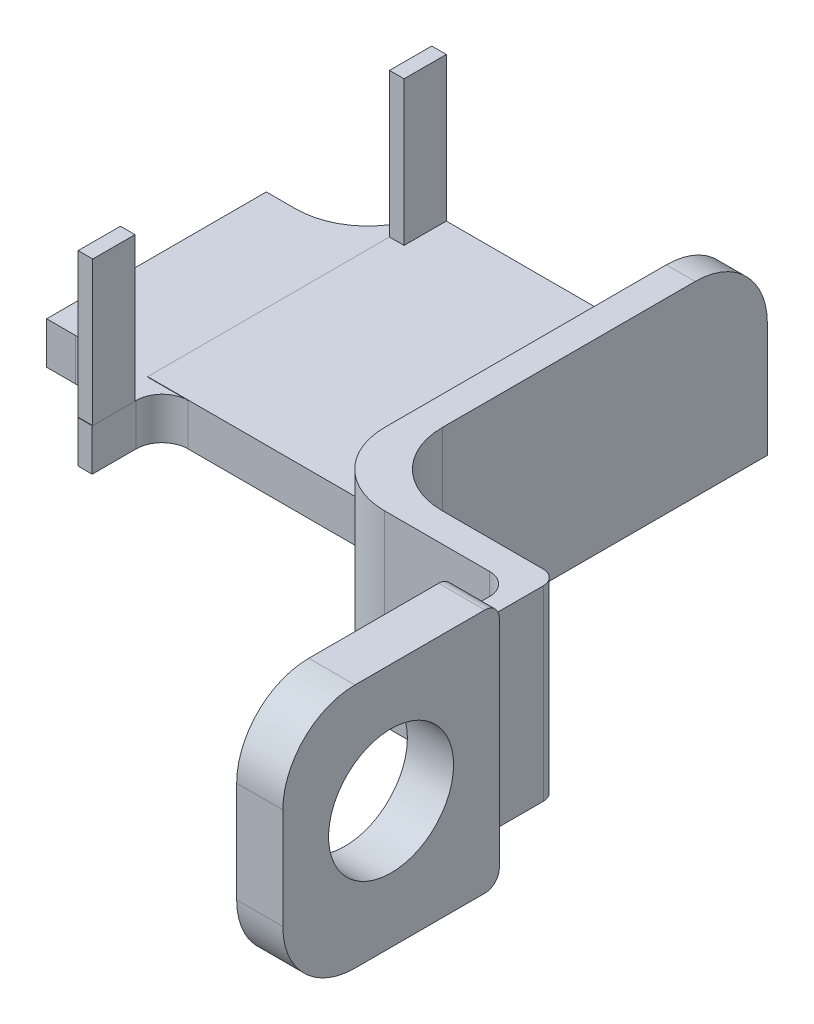
from build123d import *

# Parameters (mm, degrees)
SKETCH1_W            = 54
SKETCH1_H            = 50
BOSS_EXTRUDE1_DEPTH  = 7.460000066
SKETCH2_W            = 75
SKETCH2_H            = 7.460000066
BOSS_EXTRUDE2_DEPTH  = 5.08
SKETCH4_W            = 5.08
SKETCH4_H            = 75
BOSS_EXTRUDE3_DEPTH  = 25.4
FILLET1_R            = 12.7
SKETCH6_W            = 5.08
SKETCH6_H            = 32.860000066
BOSS_EXTRUDE4_DEPTH  = 33.02
FILLET2_R            = 12.7
FILLET3_R            = 12.7
SKETCH9_W            = 3.089134775
SKETCH9_H            = 32.860000066
BOSS_EXTRUDE5_DEPTH  = 10
SKETCH10_W           = 8.128
SKETCH10_H           = 43.18
BOSS_EXTRUDE6_DEPTH  = 38.1
FILLET4_R            = 12.7
FILLET5_R            = 2.54
SKETCH11_R           = 11
CUT_EXTRUDE1_DEPTH   = 38.1
FILLET6_R            = 2.54
FILLET7_R            = 3.81
SKETCH18_W           = 50.970977204
SKETCH18_H           = 7.39100176
BOSS_EXTRUDE8_DEPTH  = 17.78
FILLET12_R           = 12.7
SKETCH23_W           = 12.3
SKETCH23_H           = 7.39100176
BOSS_EXTRUDE9_DEPTH  = 7.62
SKETCH24_W           = 2.569580913
SKETCH24_H           = 7.435441969
BOSS_EXTRUDE10_DEPTH = 25.4
SKETCH28_W           = 17.78
SKETCH28_H           = 12.3
CUT_EXTRUDE8_DEPTH   = 25.4
FILLET14_R           = 12.7
SKETCH30_W           = 12.3
SKETCH30_H           = 7.39100176
CUT_EXTRUDE9_DEPTH   = 5.08
FILLET16_R           = 4.572


with BuildPart() as part:
    # Sketch1 → Boss-Extrude1 (new body)
    with BuildSketch(Plane(origin=(0, 0, 0), x_dir=(1, 0, 0), z_dir=(0, 1, 0))):
        with Locations((10.073929961, 6.712062257)):
            Rectangle(SKETCH1_W, SKETCH1_H)
    extrude(amount=BOSS_EXTRUDE1_DEPTH)

    # Sketch2 → Boss-Extrude2 (add)
    with BuildSketch(Plane(origin=(37.073929961, 0, 0), x_dir=(0, 0, -1), z_dir=(1, 0, 0))):
        with Locations((-5.787937743, 3.730000033)):
            Rectangle(SKETCH2_W, SKETCH2_H)
    extrude(amount=BOSS_EXTRUDE2_DEPTH)

    # Sketch4 → Boss-Extrude3 (add)
    with BuildSketch(Plane(origin=(0, 7.460000066, 0), x_dir=(1, 0, 0), z_dir=(0, 1, 0))):
        with Locations((39.613929961, -5.787937743)):
            Rectangle(SKETCH4_W, SKETCH4_H)
    extrude(amount=BOSS_EXTRUDE3_DEPTH)

    # Fillet1
    fillet1_edges = [part.edges().sort_by_distance(p)[0] for p in [
        (39.613929961, 32.860000066, -31.712062257),
    ]]
    fillet(fillet1_edges, radius=FILLET1_R)

    # Sketch6 → Boss-Extrude4 (add)
    with BuildSketch(Plane(origin=(42.153929961, 0, 0), x_dir=(0, 0, -1), z_dir=(1, 0, 0))):
        with Locations((-40.747937743, 16.430000033)):
            Rectangle(SKETCH6_W, SKETCH6_H)
    extrude(amount=BOSS_EXTRUDE4_DEPTH)

    # Fillet2
    fillet2_edges = [part.edges().sort_by_distance(p)[0] for p in [
        (42.153929961, 16.430000033, 38.207937743),
    ]]
    fillet(fillet2_edges, radius=FILLET2_R)

    # Fillet3
    fillet3_edges = [part.edges().sort_by_distance(p)[0] for p in [
        (37.073929961, 16.430000033, 43.287937743),
    ]]
    fillet(fillet3_edges, radius=FILLET3_R)

    # Sketch9 → Boss-Extrude5 (add)
    with BuildSketch(Plane.XY.offset(43.287937743)):
        with Locations((73.629362574, 16.430000033)):
            Rectangle(SKETCH9_W, SKETCH9_H)
    extrude(amount=BOSS_EXTRUDE5_DEPTH)

    # Sketch10 → Boss-Extrude6 (add)
    with BuildSketch(Plane.XY.offset(53.287937743)):
        with Locations((75.90492166, 17.526882494)):
            Rectangle(SKETCH10_W, SKETCH10_H)
    extrude(amount=BOSS_EXTRUDE6_DEPTH)

    # Fillet4
    fillet4_edges = [part.edges().sort_by_distance(p)[0] for p in [
        (75.90492166, 39.116882494, 91.387937743),
        (75.90492166, -4.063117506, 91.387937743),
    ]]
    fillet(fillet4_edges, radius=FILLET4_R)

    # Fillet5
    fillet5_edges = [part.edges().sort_by_distance(p)[0] for p in [
        (75.90492166, 39.116882494, 53.287937743),
        (75.90492166, -4.063117506, 53.287937743),
    ]]
    fillet(fillet5_edges, radius=FILLET5_R)

    # Sketch11 → Cut-Extrude1 (cut)
    with BuildSketch(Plane(origin=(79.96892166, 0, 0), x_dir=(0, 0, -1), z_dir=(1, 0, 0))):
        with Locations((-72.337937743, 18.275557959)):
            Circle(SKETCH11_R)
    extrude(amount=-CUT_EXTRUDE1_DEPTH, mode=Mode.SUBTRACT)

    # Fillet6
    fillet6_edges = [part.edges().sort_by_distance(p)[0] for p in [
        (75.173929961, 16.430000033, 38.207937743),
    ]]
    fillet(fillet6_edges, radius=FILLET6_R)

    # Fillet7
    fillet7_edges = [part.edges().sort_by_distance(p)[0] for p in [
        (72.084795186, 16.430000033, 43.287937743),
    ]]
    fillet(fillet7_edges, radius=FILLET7_R)

    # Sketch18 → Boss-Extrude8 (add)
    with BuildSketch(Plane.ZY.offset(16.926070039)):
        with Locations((5.102449141, 3.69550088)):
            Rectangle(SKETCH18_W, SKETCH18_H)
    extrude(amount=BOSS_EXTRUDE8_DEPTH)

    # Fillet12
    # the kernel refuses this fillet: 12.7 mm, written as the material it adds along each edge
    with BuildSketch(Plane(origin=(-16.926070039, 7.39100176, -20.383039461), x_dir=(0, 0, -1), z_dir=(0, -1, 0))) as fillet12_piece_1:
        with BuildLine():
            CenterArc((12.7, -12.625783996), FILLET12_R, 96.197210877, 83.802789123)
            Line((0, -12.625783996), (-0.254, -12.625783996))
            Line((-0.254, -12.625783996), (-0.254, 0))
            Line((-0.254, 0), (0, 0.254))
            ThreePointArc((0, 0.254), (5.664511398, 0.254), (11.301603252, 0.25251568))
            Line((11.301603252, 0.25251568), (11.329022796, 0))
        make_face()
    extrude(amount=7.39100176)

    # Sketch23 → Boss-Extrude9 (add)
    with BuildSketch(Plane(origin=(-16.926070039, 0, 0), x_dir=(0, 0, -1), z_dir=(1, 0, 0))):
        with Locations((-24.437937743, 3.69550088)):
            Rectangle(SKETCH23_W, SKETCH23_H)
    extrude(amount=BOSS_EXTRUDE9_DEPTH)

    # Sketch24 → Boss-Extrude10 (add)
    with BuildSketch(Plane(origin=(0, 7.460000066, 0), x_dir=(1, 0, 0), z_dir=(0, 1, 0))):
        with Locations((-15.641279583, 27.994341273)):
            Rectangle(SKETCH24_W, SKETCH24_H)
        with Locations((-15.571212374, -26.873353003)):
            Rectangle(SKETCH24_W, SKETCH24_H)
    extrude(amount=BOSS_EXTRUDE10_DEPTH)


with BuildPart() as boss_extrude10_piece_1:
    # of the separate pieces the step leaves, piece 1, a body of its own (boss_extrude10_pieces)
    add(part.part.solids().sort_by_distance((-16.926070039, 0, -31.712062257))[0])

    # Sketch28 → Cut-Extrude8 (cut)
    with BuildSketch(Plane(origin=(0, 7.39100176, 0), x_dir=(1, 0, 0), z_dir=(0, 1, 0))):
        with Locations((-25.816070039, -24.437937743)):
            Rectangle(SKETCH28_W, SKETCH28_H)
    extrude(amount=-CUT_EXTRUDE8_DEPTH, mode=Mode.SUBTRACT)

    # Fillet14
    # the kernel refuses this fillet: 12.7 mm, written as the material it adds along each edge
    with BuildSketch(Plane(origin=(-16.926070039, 7.39100176, 18.287937743), x_dir=(-1, 0, 0), z_dir=(0, -1, 0))) as fillet14_piece_1:
        with BuildLine():
            CenterArc((12.693699224, -12.7), FILLET14_R, 90, 88.195110026)
            Line((0, -12.3), (-0.253873984, -12.292))
            ThreePointArc((-0.253873984, -12.292), (-0.254, -6.15), (-0.254, 0))
            Line((-0.254, 0), (0, 0.254))
            Line((0, 0.254), (12.693699224, 0.254))
            Line((12.693699224, 0.254), (12.693699224, 0))
        make_face()
    extrude(amount=7.39100176)

    # Sketch30 → Cut-Extrude9 (cut)
    with BuildSketch(Plane(origin=(-9.306070039, 0, 0), x_dir=(0, 0, -1), z_dir=(1, 0, 0))):
        with Locations((-24.437937743, 3.69550088)):
            Rectangle(SKETCH30_W, SKETCH30_H)
    extrude(amount=-CUT_EXTRUDE9_DEPTH, mode=Mode.SUBTRACT)

    # Fillet16
    fillet16_edges = [boss_extrude10_piece_1.edges().sort_by_distance(p)[0] for p in [
        (-14.386070039, 3.69550088, 18.287937743),
    ]]
    fillet(fillet16_edges, radius=FILLET16_R)


with BuildPart() as boss_extrude10_piece_2:
    # of the separate pieces the step leaves, piece 2, a body of its own (boss_extrude10_pieces)
    add(part.part.solids().sort_by_distance((-16.856002831, 7.460000066, 23.155632018))[0])


solid = Compound([boss_extrude10_piece_1.part, boss_extrude10_piece_2.part])
